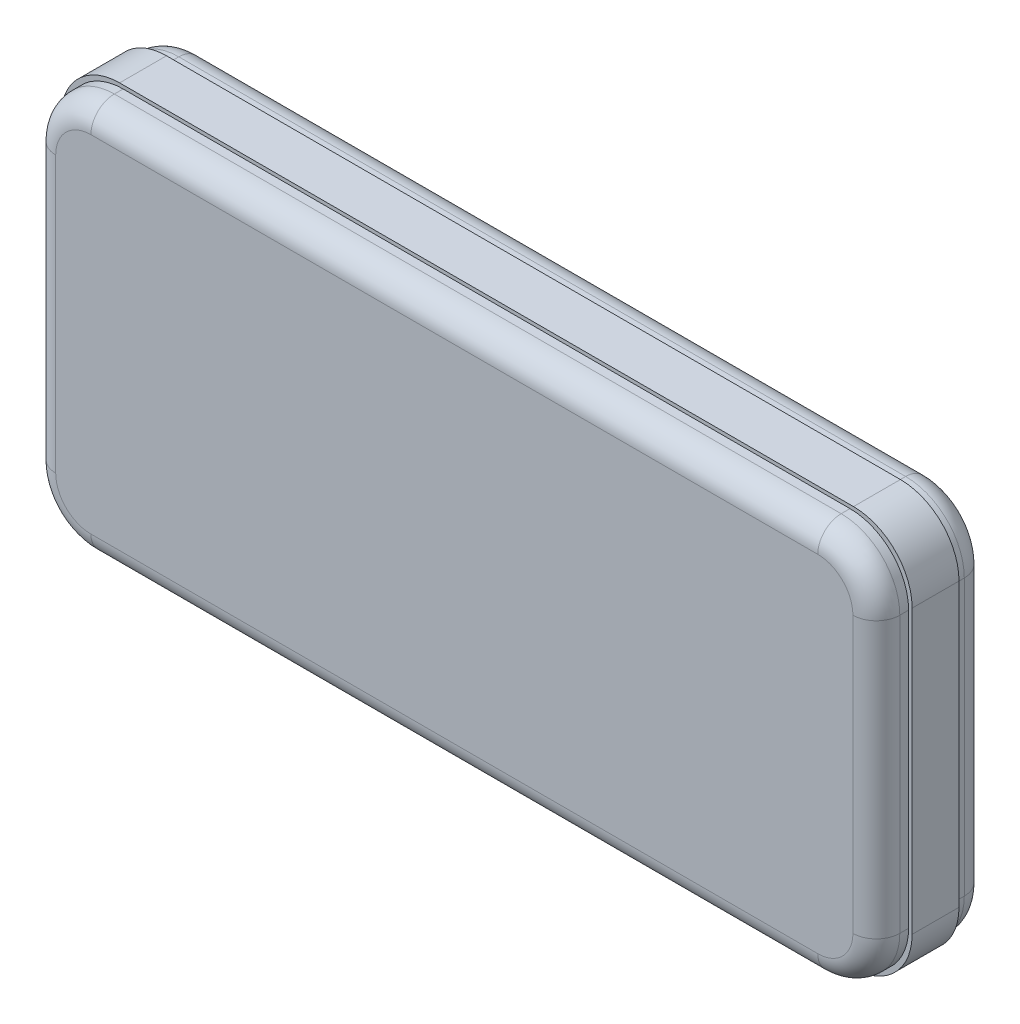
from build123d import *

# Parameters (mm, degrees)
ESQUISSE1_W        = 144
ESQUISSE1_H        = 67
BOSS_EXTRU_1_DEPTH = 9.5
CONG_2_R           = 10
CONG_1_R           = 4
ESQUISSE3_W        = 145.2
ESQUISSE3_H        = 68.2
ESQUISSE3_W_2      = 144
ESQUISSE3_H_2      = 67
BOSS_EXTRU_2_DEPTH = 4
CONG_3_START       = -4
CONG_3_DEPTH       = 8
CONG_3_2_DEPTH     = 8


with BuildPart() as part:
    # Esquisse1 → Boss.-Extru.1 (new, symmetric)
    with BuildSketch(Plane.XY):
        Rectangle(ESQUISSE1_W, ESQUISSE1_H)
    extrude(amount=BOSS_EXTRU_1_DEPTH, both=True)

    # Congé2
    cong_2_edges = [part.edges().sort_by_distance(p)[0] for p in [
        (-72, 33.5, 0),
        (72, 33.5, 0),
        (72, -33.5, 0),
        (-72, -33.5, 0),
    ]]
    fillet(cong_2_edges, radius=CONG_2_R)

    # Congé1
    cong_1_edges = [part.edges().sort_by_distance(p)[0] for p in [
        (0, -33.5, -9.5),
        (0, -33.5, 9.5),
        (-72, 0, -9.5),
        (0, 33.5, -9.5),
        (72, 0, -9.5),
        (69.071067812, 30.571067812, -9.5),
        (69.071067812, -30.571067812, -9.5),
        (-69.071067812, 30.571067812, -9.5),
        (-69.071067812, -30.571067812, -9.5),
        (-72, 0, 9.5),
        (72, 0, 9.5),
        (0, 33.5, 9.5),
        (69.071067812, 30.571067812, 9.5),
        (69.071067812, -30.571067812, 9.5),
        (-69.071067812, 30.571067812, 9.5),
        (-69.071067812, -30.571067812, 9.5),
    ]]
    fillet(cong_1_edges, radius=CONG_1_R)

    # Esquisse3 → Boss.-Extru.2 (add, symmetric)
    with BuildSketch(Plane.XY):
        Rectangle(ESQUISSE3_W, ESQUISSE3_H)
        Rectangle(ESQUISSE3_W_2, ESQUISSE3_H_2, mode=Mode.SUBTRACT)
    extrude(amount=BOSS_EXTRU_2_DEPTH, both=True)

    # Congé3: read off the stored shape, not the designer's step
    # Congé3 outline → Congé3 (cut)
    with BuildSketch(Plane.XY.offset(CONG_3_START)):
        with BuildLine():
            Line((-72.6, 34.1), (-72.6, 24.1))
            ThreePointArc((-72.6, 24.1), (-72.448857802, 25.832050808), (-72, 27.511744422))
            Line((-72, 27.511744422), (-72, 33.5))
            Line((-72, 33.5), (-66.011744422, 33.5))
            ThreePointArc((-66.011744422, 33.5), (-64.332050808, 33.948857802), (-62.6, 34.1))
            Line((-62.6, 34.1), (-72.6, 34.1))
        make_face()
        with BuildLine():
            ThreePointArc((-72, -27.511744422), (-72.448857802, -25.832050808), (-72.6, -24.1))
            Line((-72.6, -24.1), (-72.6, -34.1))
            Line((-72.6, -34.1), (-62.6, -34.1))
            ThreePointArc((-62.6, -34.1), (-64.332050808, -33.948857802), (-66.011744422, -33.5))
            Line((-66.011744422, -33.5), (-72, -33.5))
            Line((-72, -33.5), (-72, -27.511744422))
        make_face()
        with BuildLine():
            Line((72.6, 34.1), (62.6, 34.1))
            ThreePointArc((62.6, 34.1), (64.332050808, 33.948857802), (66.011744422, 33.5))
            Line((66.011744422, 33.5), (72, 33.5))
            Line((72, 33.5), (72, 27.511744422))
            ThreePointArc((72, 27.511744422), (72.448857802, 25.832050808), (72.6, 24.1))
            Line((72.6, 24.1), (72.6, 34.1))
        make_face()
        with BuildLine():
            ThreePointArc((66.011744422, -33.5), (64.332050808, -33.948857802), (62.6, -34.1))
            Line((62.6, -34.1), (72.6, -34.1))
            Line((72.6, -34.1), (72.6, -24.1))
            ThreePointArc((72.6, -24.1), (72.448857802, -25.832050808), (72, -27.511744422))
            Line((72, -27.511744422), (72, -33.5))
            Line((72, -33.5), (66.011744422, -33.5))
        make_face()
    extrude(amount=CONG_3_DEPTH, mode=Mode.SUBTRACT)

    # Cong_3 2 outline → Cong_3 2 (add)
    with BuildSketch(Plane.XY.offset(CONG_3_START)):
        with BuildLine():
            ThreePointArc((-66.011744422, 33.5), (-69.671067812, 31.171067812), (-72, 27.511744422))
            Line((-72, 27.511744422), (-72, 23.5))
            ThreePointArc((-72, 23.5), (-69.071067812, 30.571067812), (-62, 33.5))
            Line((-62, 33.5), (-66.011744422, 33.5))
        make_face()
        with BuildLine():
            Line((-72, -23.5), (-72, -27.511744422))
            ThreePointArc((-72, -27.511744422), (-69.671067812, -31.171067812), (-66.011744422, -33.5))
            Line((-66.011744422, -33.5), (-62, -33.5))
            ThreePointArc((-62, -33.5), (-69.071067812, -30.571067812), (-72, -23.5))
        make_face()
        with BuildLine():
            ThreePointArc((72, 27.511744422), (69.671067812, 31.171067812), (66.011744422, 33.5))
            Line((66.011744422, 33.5), (62, 33.5))
            ThreePointArc((62, 33.5), (69.071067812, 30.571067812), (72, 23.5))
            Line((72, 23.5), (72, 27.511744422))
        make_face()
        with BuildLine():
            Line((62, -33.5), (66.011744422, -33.5))
            ThreePointArc((66.011744422, -33.5), (69.671067812, -31.171067812), (72, -27.511744422))
            Line((72, -27.511744422), (72, -23.5))
            ThreePointArc((72, -23.5), (69.071067812, -30.571067812), (62, -33.5))
        make_face()
    extrude(amount=CONG_3_2_DEPTH)


solid = part.part
